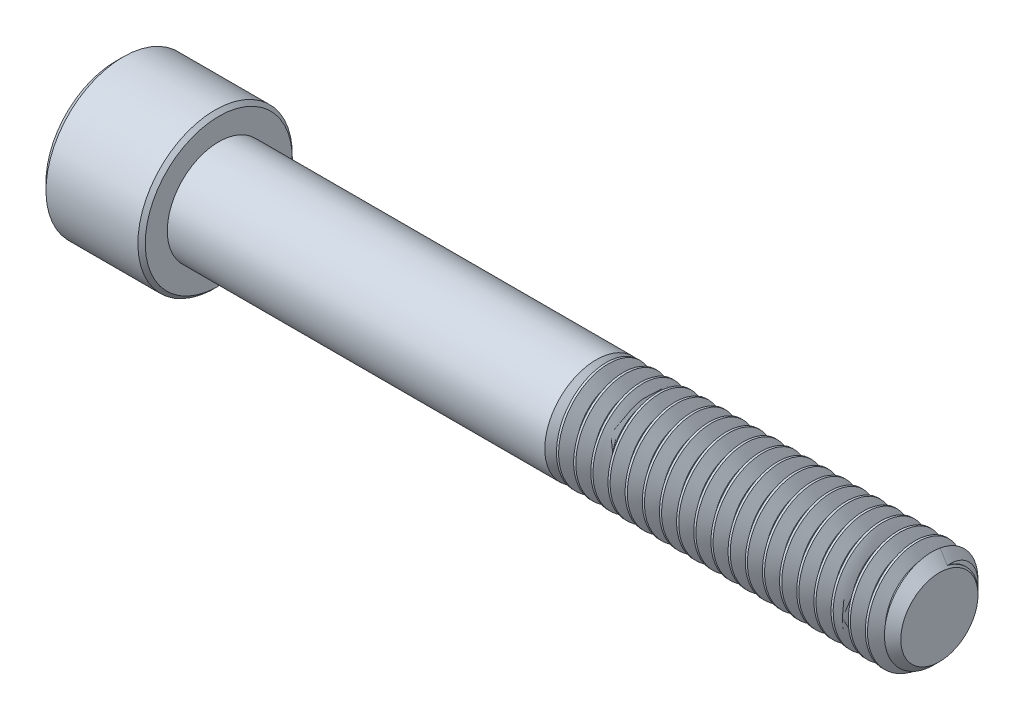
from build123d import *

# Parameters (mm, degrees)
SKETCH2_R           = 4.7625
BOSS_EXTRUDE1_DEPTH = 31.75
CHAMFER1_SIZE       = 1.190625
CUT_SWEEP1_PITCH    = 1.5875
CUT_EXTRUDE1_DEPTH  = 4.6228
SKETCH8_R           = 4.582717762
CUT_EXTRUDE2_DEPTH  = 1.360714286
CUT_EXTRUDE2_DRAFT  = -45


with BuildPart() as part:
    # Sketch2 → Boss-Extrude1 (new body)
    with BuildSketch(Plane(origin=(33.3375, 0, 0), x_dir=(0, 0, -1), z_dir=(1, 0, 0))):
        Circle(SKETCH2_R)
    extrude(amount=-BOSS_EXTRUDE1_DEPTH)

    # Chamfer1
    chamfer1_edges = [part.edges().sort_by_distance(p)[0] for p in [
        (33.3375, 0, 4.7625),
    ]]
    chamfer(chamfer1_edges, length=CHAMFER1_SIZE)

    # Cut-Sweep1: the profile of Sketch5 profile screwed along a right-hand helix of 21 turns, 8 arcs to a turn; built about Z, then put on its axis
    cut_sweep1_z = Axis((0, 0, 0), (0, 0, 1))
    cut_sweep1_corners = [(4.7628, 0, 0.694704455), (4.7628, 0, -0.694704455), (3.731388504, 0, -0.09921875), (3.731388504, 0, 0.09921875)]
    with BuildLine(mode=Mode.PRIVATE) as cut_sweep1_profile:
        Line(cut_sweep1_corners[0], cut_sweep1_corners[1])
        Line(cut_sweep1_corners[1], cut_sweep1_corners[2])
        Line(cut_sweep1_corners[2], cut_sweep1_corners[3])
        Line(cut_sweep1_corners[3], cut_sweep1_corners[0])
    cut_sweep1_cap = Face(cut_sweep1_profile.wire())
    cut_sweep1_turn_angles = [0, 22.5, 45, 67.5, 90, 112.5, 135, 157.5, 180, 202.5, 225, 247.5, 270, 292.5, 315, 337.5, 360]
    cut_sweep1_turn_weights = [1, 0.9238795325112867, 1, 0.9238795325112867, 1, 0.9238795325112867, 1, 0.9238795325112867, 1, 0.9238795325112867, 1, 0.9238795325112867, 1, 0.9238795325112867, 1, 0.9238795325112867, 1]
    cut_sweep1_turn_rails = [Edge.make_bspline([Vector(p[0], p[1], 0).rotate(cut_sweep1_z, cut_sweep1_turn_angles[k]) / cut_sweep1_turn_weights[k] + Vector(0, 0, p[2] + CUT_SWEEP1_PITCH * cut_sweep1_turn_angles[k] / 360) for k in range(17)], [0, 0, 0, 1, 1, 2, 2, 3, 3, 4, 4, 5, 5, 6, 6, 7, 7, 8, 8, 8], 2, cut_sweep1_turn_weights) for p in cut_sweep1_corners]
    cut_sweep1_turn_sides = [Face.make_surface_from_curves(cut_sweep1_turn_rails[p[0]], cut_sweep1_turn_rails[p[1]]) for p in [(0, 1), (1, 2), (2, 3), (3, 0)]]
    cut_sweep1 = Plane(origin=(33.3375, 0, 0), x_dir=(0, 1, 0), z_dir=(-1, 0, 0)) * Solid(Shell([*[p.moved(Location((0, 0, CUT_SWEEP1_PITCH * i))) for i in range(21) for p in cut_sweep1_turn_sides], cut_sweep1_cap, cut_sweep1_cap.rotate(cut_sweep1_z, 7560).moved(Location((0, 0, CUT_SWEEP1_PITCH * 7560 / 360)))]))
    add(cut_sweep1, mode=Mode.SUBTRACT)

    # Sketch10 → Revolve2 (revolve)
    with BuildSketch(Plane.XY, mode=Mode.PRIVATE) as revolve2_sk:
        Polygon((-33.3375, 0), (-33.3375, 4.7625), (1.5875, 4.7625), (6.35, 0), align=None)
    revolve(revolve2_sk.sketch.rotate(Axis((-33.3375, 0, 0), (1, 0, 0)), 292.5), axis=Axis((-33.3375, 0, 0), (1, 0, 0)))

    # Sketch6 → Revolve1 (revolve)
    with BuildSketch(Plane.XY, mode=Mode.PRIVATE) as revolve1_sk:
        Polygon((-42.182142857, 7.14375), (-42.8625, 6.463392857), (-42.8625, 0), (-33.3375, 0), (-33.3375, 6.803571429), (-33.677678571, 7.14375), align=None)
    revolve(revolve1_sk.sketch.rotate(Axis((-33.3375, 0, 0), (-1, 0, 0)), 67.5), axis=Axis((-33.3375, 0, 0), (-1, 0, 0)))

    # Sketch4 → Cut-Extrude1 (cut)
    with BuildSketch(Plane(origin=(-42.8625, 0, 0), x_dir=(0, 0, -1), z_dir=(1, 0, 0))):
        Polygon((0, 4.582717762), (-3.96875, 2.291358881), (-3.96875, -2.291358881), (0, -4.582717762), (3.96875, -2.291358881), (3.96875, 2.291358881), align=None)
    extrude(amount=CUT_EXTRUDE1_DEPTH, mode=Mode.SUBTRACT)


with BuildPart() as cut_extrude2_tool:
    # Sketch8 → Cut-Extrude2 (with draft: the straight prism first)
    with BuildSketch(Plane.ZY.offset(42.8625)):
        Circle(SKETCH8_R)
    extrude(amount=-CUT_EXTRUDE2_DEPTH)
    # Cut-Extrude2: the draft: its side faces are tilted about the plane it starts from
    cut_extrude2_sides = [cut_extrude2_tool.faces().sort_by_distance(p)[0] for p in [
        (-42.182142857, 0, -4.582717762),
    ]]
    draft(cut_extrude2_sides, Plane.ZY.offset(42.8625), CUT_EXTRUDE2_DRAFT)


with BuildPart() as part_1:
    add(part.part)

    # Cut-Extrude2: cut by cut_extrude2_tool
    add(cut_extrude2_tool.part, mode=Mode.SUBTRACT)


solid = part_1.part
